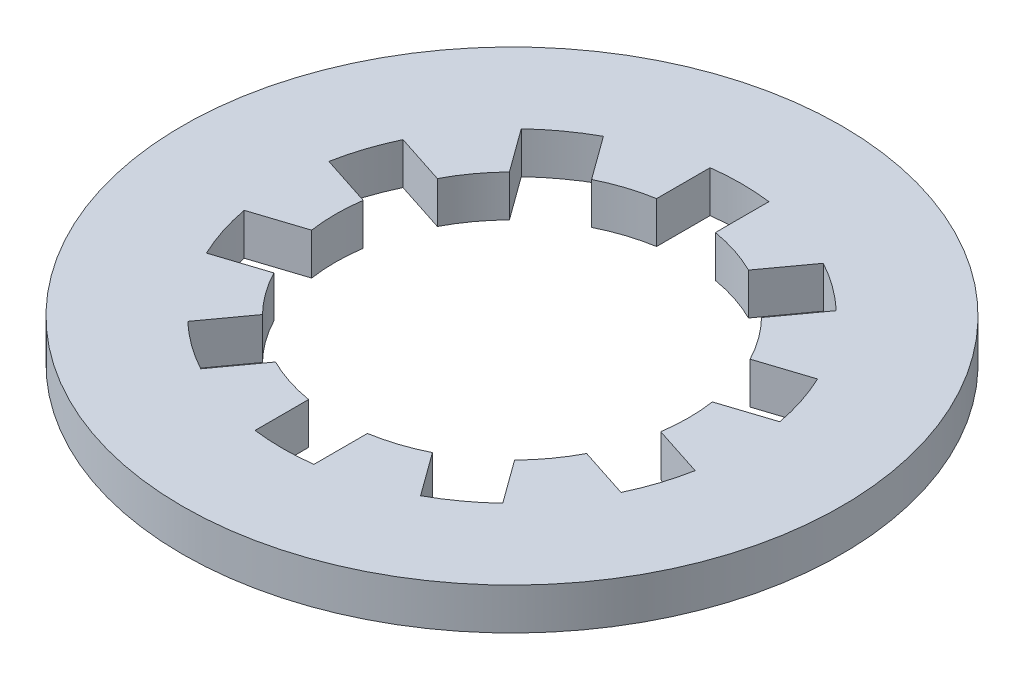
from build123d import *

# Parameters (mm, degrees)
SKETCH1_R          = 4.8387
SKETCH1_R_2        = 2.5908
EXTRUDE1_DEPTH     = 0.6096
CUT_EXTRUDE1_DEPTH = 7.870054406
CIRPATTERN1_COUNT  = 10


with BuildPart() as part:
    # Sketch1 → Extrude1 (new body)
    with BuildSketch(Plane(origin=(0, 0, 0), x_dir=(1, 0, 0), z_dir=(0, 1, 0))):
        Circle(SKETCH1_R)
        Circle(SKETCH1_R_2, mode=Mode.SUBTRACT)
    extrude(amount=EXTRUDE1_DEPTH)

    # Sketch2 → Cut-Extrude1 (cut, through all)
    with BuildSketch(Plane(origin=(0, 0.6096, 0), x_dir=(-1, 0, 0), z_dir=(0, 1, 0))):
        with BuildLine():
            Line((-0.4318, 3.34024583), (-0.4318, 2.55456325))
            ThreePointArc((-0.4318, 2.55456325), (0, 2.5908), (0.4318, 2.55456325))
            Line((0.4318, 2.55456325), (0.4318, 3.34024583))
            ThreePointArc((0.4318, 3.34024583), (0, 3.36804), (-0.4318, 3.34024583))
        make_face()
    cut_extrude1 = extrude(amount=-CUT_EXTRUDE1_DEPTH, mode=Mode.SUBTRACT)

    # CirPattern1: Cut-Extrude1 ×10 about axis
    cirpattern1_axis = Axis((0, 4.516350408, 0), (0, -1, 0))
    for i in range(1, CIRPATTERN1_COUNT):
        add(cut_extrude1.rotate(cirpattern1_axis, i * 360 / CIRPATTERN1_COUNT), mode=Mode.SUBTRACT)


solid = part.part
